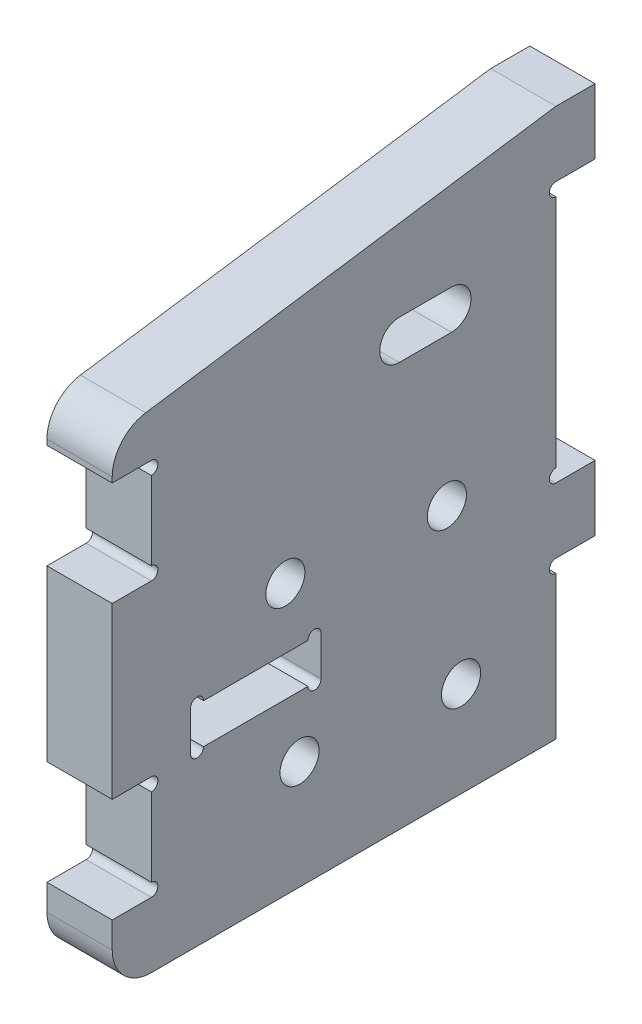
from build123d import *

# Parameters (mm, degrees)
SKETCH1_R           = 1.5
BOSS_EXTRUDE1_DEPTH = 5
SKETCH2_W           = 3
SKETCH2_H           = 8
SKETCH2_W_2         = 10
SKETCH2_H_2         = 3.05
CUT_EXTRUDE1_DEPTH  = 35.770677301
CUT_EXTRUDE2_DEPTH  = 35.770677301
CUT_EXTRUDE3_DEPTH  = 10
FILLET1_R           = 3


with BuildPart() as part:
    # Sketch1 → Boss-Extrude1 (new body)
    with BuildSketch(Plane(origin=(0, 0, 0), x_dir=(0, 0, -1), z_dir=(1, 0, 0))):
        Polygon((17, 28), (17, 23), (14, 23), (14, 3), (17, 3), (17, -2), (14, -2), (14, -14), (-20, -14), (-20, 23), (14, 28), align=None)
        with Locations((-6.733876165, 6.701112728)):
            Circle(SKETCH1_R, mode=Mode.SUBTRACT)
        with Locations((-5.643042298, -5.67063256)):
            Circle(SKETCH1_R, mode=Mode.SUBTRACT)
        with Locations((6.733876165, -6.701112728)):
            Circle(SKETCH1_R, mode=Mode.SUBTRACT)
        with Locations((5.643042298, 5.67063256)):
            Circle(SKETCH1_R, mode=Mode.SUBTRACT)
    extrude(amount=BOSS_EXTRUDE1_DEPTH)

    # Sketch2 → Cut-Extrude1 (cut, through all)
    with BuildSketch(Plane(origin=(5, 0, 0), x_dir=(0, 0, -1), z_dir=(1, 0, 0))):
        with Locations((-18.5, 16)):
            Rectangle(SKETCH2_W, SKETCH2_H)
        with Locations((-9, 0.525)):
            Rectangle(SKETCH2_W_2, SKETCH2_H_2)
        with Locations((-18.5, -5)):
            Rectangle(SKETCH2_W, SKETCH2_H)
    extrude(amount=-CUT_EXTRUDE1_DEPTH, mode=Mode.SUBTRACT)

    # Sketch3 → Cut-Extrude2 (cut, through all)
    with BuildSketch(Plane(origin=(5, 0, 0), x_dir=(0, 0, -1), z_dir=(1, 0, 0))):
        with BuildLine():
            Line((14, 22), (14, 23))
            ThreePointArc((14, 23), (13.5, 22.5), (14, 22))
        make_face()
        with BuildLine():
            Line((14, 3), (14, 4))
            ThreePointArc((14, 4), (13.5, 3.5), (14, 3))
        make_face()
        with BuildLine():
            Line((14, -3), (14, -2))
            ThreePointArc((14, -2), (13.5, -2.5), (14, -3))
        make_face()
        with BuildLine():
            Line((-5, 2.05), (-4, 2.05))
            ThreePointArc((-4, 2.05), (-4.5, 2.55), (-5, 2.05))
        make_face()
        with BuildLine():
            Line((-14, 2.05), (-13, 2.05))
            ThreePointArc((-13, 2.05), (-13.5, 2.55), (-14, 2.05))
        make_face()
        with BuildLine():
            Line((-13, -1), (-14, -1))
            ThreePointArc((-14, -1), (-13.5, -1.5), (-13, -1))
        make_face()
        with BuildLine():
            Line((-4, -1), (-5, -1))
            ThreePointArc((-5, -1), (-4.5, -1.5), (-4, -1))
        make_face()
        with BuildLine():
            ThreePointArc((-17, -9), (-16.5, -8.5), (-17, -8))
            Line((-17, -8), (-17, -9))
        make_face()
        with BuildLine():
            ThreePointArc((-17, -2), (-16.5, -1.5), (-17, -1))
            Line((-17, -1), (-17, -2))
        make_face()
        with BuildLine():
            ThreePointArc((-17, 12), (-16.5, 12.5), (-17, 13))
            Line((-17, 13), (-17, 12))
        make_face()
        with BuildLine():
            ThreePointArc((-17, 19), (-16.5, 19.5), (-17, 20))
            Line((-17, 20), (-17, 19))
        make_face()
    extrude(amount=-CUT_EXTRUDE2_DEPTH, mode=Mode.SUBTRACT)

    # Sketch4 → Cut-Extrude3 (cut)
    with BuildSketch(Plane(origin=(5, 0, 0), x_dir=(0, 0, -1), z_dir=(1, 0, 0))):
        with BuildLine():
            Line((2, 20), (6, 20))
            ThreePointArc((6, 20), (7.5, 18.5), (6, 17))
            Line((6, 17), (2, 17))
            ThreePointArc((2, 17), (0.5, 18.5), (2, 20))
        make_face()
    extrude(amount=-CUT_EXTRUDE3_DEPTH, mode=Mode.SUBTRACT)

    # Fillet1
    fillet1_edges = [part.edges().sort_by_distance(p)[0] for p in [
        (2.5, 23, 20),
        (2.5, -14, 20),
    ]]
    fillet(fillet1_edges, radius=FILLET1_R)


solid = part.part
